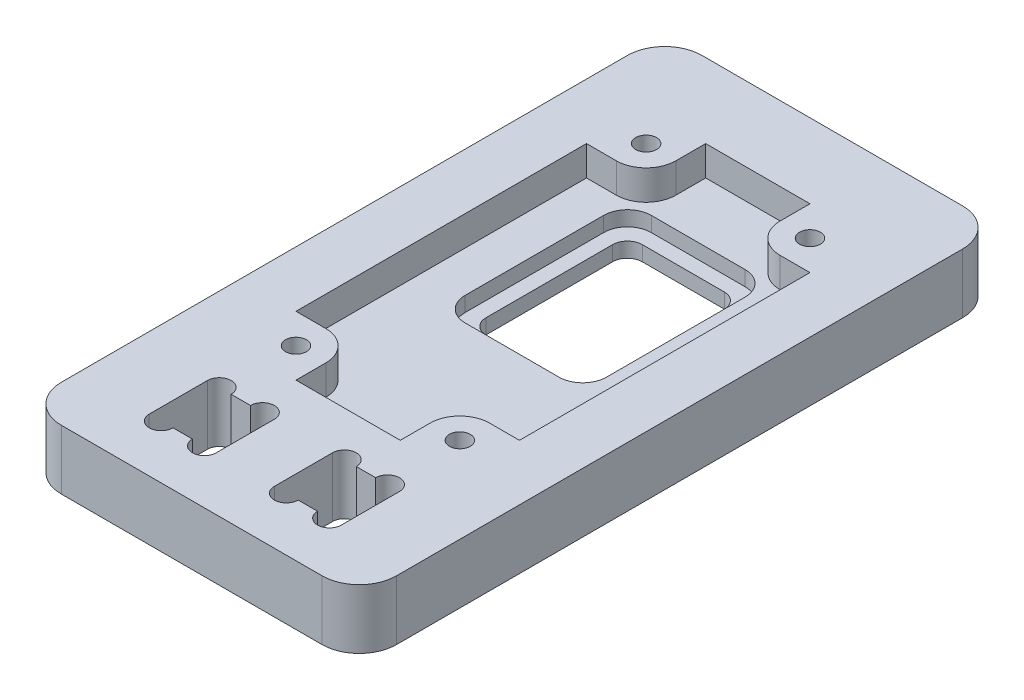
from build123d import *

# Parameters (mm, degrees)
BOSS_EXTRUDE1_DEPTH = 8
CUT_EXTRUDE1_START  = -4
SKETCH3_R           = 1.4
CUT_EXTRUDE1_DEPTH  = 4
CUT_EXTRUDE2_DEPTH  = 2


with BuildPart() as part:
    # Sketch1 → Boss-Extrude1 (new body)
    with BuildSketch(Plane(origin=(0, 0, 0), x_dir=(1, 0, 0), z_dir=(0, 1, 0))):
        with BuildLine():
            Line((25, 41), (-10, 41))
            ThreePointArc((-10, 41), (-13.535533906, 39.535533906), (-15, 36))
            Line((-15, 36), (-15, -40))
            ThreePointArc((-15, -40), (-13.535533906, -43.535533906), (-10, -45))
            Line((-10, -45), (25, -45))
            ThreePointArc((25, -45), (28.535533906, -43.535533906), (30, -40))
            Line((30, -40), (30, 36))
            ThreePointArc((30, 36), (28.535533906, 39.535533906), (25, 41))
        make_face()
        with BuildLine():
            Line((-5.4, -37.8), (-5.4, -30))
            ThreePointArc((-5.4, -30), (-3.8, -28.4), (-2.2, -30))
            Line((-2.2, -30), (0.4, -30))
            ThreePointArc((0.4, -30), (2, -28.4), (3.6, -30))
            Line((3.6, -30), (3.6, -37.8))
            ThreePointArc((3.6, -37.8), (2, -39.4), (0.4, -37.8))
            Line((0.4, -37.8), (-2.2, -37.8))
            ThreePointArc((-2.2, -37.8), (-3.8, -39.4), (-5.4, -37.8))
        make_face(mode=Mode.SUBTRACT)
        with BuildLine():
            Line((11.4, -37.8), (11.4, -30))
            ThreePointArc((11.4, -30), (13, -28.4), (14.6, -30))
            Line((14.6, -30), (17.2, -30))
            ThreePointArc((17.2, -30), (18.8, -28.4), (20.4, -30))
            Line((20.4, -30), (20.4, -37.8))
            ThreePointArc((20.4, -37.8), (18.8, -39.4), (17.2, -37.8))
            Line((17.2, -37.8), (14.6, -37.8))
            ThreePointArc((14.6, -37.8), (13, -39.4), (11.4, -37.8))
        make_face(mode=Mode.SUBTRACT)
        with BuildLine():
            Line((13, 0), (2, 0))
            ThreePointArc((2, 0), (0.585786438, 0.585786438), (0, 2))
            Line((0, 2), (0, 19))
            ThreePointArc((0, 19), (0.585786438, 20.414213562), (2, 21))
            Line((2, 21), (13, 21))
            ThreePointArc((13, 21), (14.414213562, 20.414213562), (15, 19))
            Line((15, 19), (15, 2))
            ThreePointArc((15, 2), (14.414213562, 0.585786438), (13, 0))
        make_face(mode=Mode.SUBTRACT)
    extrude(amount=BOSS_EXTRUDE1_DEPTH)

    # Sketch3 → Cut-Extrude1 (cut)
    # profile 1 of 5: a face of its own
    with BuildSketch(Plane(origin=(0, 8, 0), x_dir=(1, 0, 0), z_dir=(0, 1, 0)).offset(CUT_EXTRUDE1_START)):
        with BuildLine():
            Line((14.5, 31), (0.5, 31))
            Line((0.5, 31), (0.5, 27))
            ThreePointArc((0.5, 27), (-0.671572875, 24.171572875), (-3.5, 23))
            Line((-3.5, 23), (-7.5, 23))
            Line((-7.5, 23), (-7.5, -16))
            Line((-7.5, -16), (-3.5, -16))
            ThreePointArc((-3.5, -16), (-0.671572875, -17.171572875), (0.5, -20))
            Line((0.5, -20), (0.5, -24))
            Line((0.5, -24), (14.5, -24))
            Line((14.5, -24), (14.5, -20))
            ThreePointArc((14.5, -20), (15.671572875, -17.171572875), (18.5, -16))
            Line((18.5, -16), (22.5, -16))
            Line((22.5, -16), (22.5, 23))
            Line((22.5, 23), (18.5, 23))
            ThreePointArc((18.5, 23), (15.671572875, 24.171572875), (14.5, 27))
            Line((14.5, 27), (14.5, 31))
        make_face()
        with BuildLine():
            ThreePointArc((2, 0), (0.585786438, 0.585786438), (0, 2))
            Line((0, 2), (0, 19))
            ThreePointArc((0, 19), (0.585786438, 20.414213562), (2, 21))
            Line((2, 21), (13, 21))
            ThreePointArc((13, 21), (14.414213562, 20.414213562), (15, 19))
            Line((15, 19), (15, 2))
            ThreePointArc((15, 2), (14.414213562, 0.585786438), (13, 0))
            Line((13, 0), (2, 0))
        make_face(mode=Mode.SUBTRACT)
    # profile 2 of 5: a face of its own
    with BuildSketch(Plane(origin=(0, 8, 0), x_dir=(1, 0, 0), z_dir=(0, 1, 0)).offset(CUT_EXTRUDE1_START)):
        with Locations((-3.5, 27)):
            Circle(SKETCH3_R)
    # profile 3 of 5: a face of its own
    with BuildSketch(Plane(origin=(0, 8, 0), x_dir=(1, 0, 0), z_dir=(0, 1, 0)).offset(CUT_EXTRUDE1_START)):
        with Locations((18.5, 27)):
            Circle(SKETCH3_R)
    # profile 4 of 5: a face of its own
    with BuildSketch(Plane(origin=(0, 8, 0), x_dir=(1, 0, 0), z_dir=(0, 1, 0)).offset(CUT_EXTRUDE1_START)):
        with Locations((-3.5, -20)):
            Circle(SKETCH3_R)
    # profile 5 of 5: a face of its own
    with BuildSketch(Plane(origin=(0, 8, 0), x_dir=(1, 0, 0), z_dir=(0, 1, 0)).offset(CUT_EXTRUDE1_START)):
        with Locations((18.5, -20)):
            Circle(SKETCH3_R)
    extrude(amount=CUT_EXTRUDE1_DEPTH, mode=Mode.SUBTRACT)

    # Sketch5 → Cut-Extrude2 (cut)
    with BuildSketch(Plane(origin=(0, 4, 0), x_dir=(1, 0, 0), z_dir=(0, 1, 0))):
        with BuildLine():
            Line((1.2, -2), (13.8, -2))
            ThreePointArc((13.8, -2), (16.0627417, -1.0627417), (17, 1.2))
            Line((17, 1.2), (17, 19.8))
            ThreePointArc((17, 19.8), (16.0627417, 22.0627417), (13.8, 23))
            Line((13.8, 23), (1.2, 23))
            ThreePointArc((1.2, 23), (-1.0627417, 22.0627417), (-2, 19.8))
            Line((-2, 19.8), (-2, 1.2))
            ThreePointArc((-2, 1.2), (-1.0627417, -1.0627417), (1.2, -2))
        make_face()
    extrude(amount=-CUT_EXTRUDE2_DEPTH, mode=Mode.SUBTRACT)


solid = part.part
